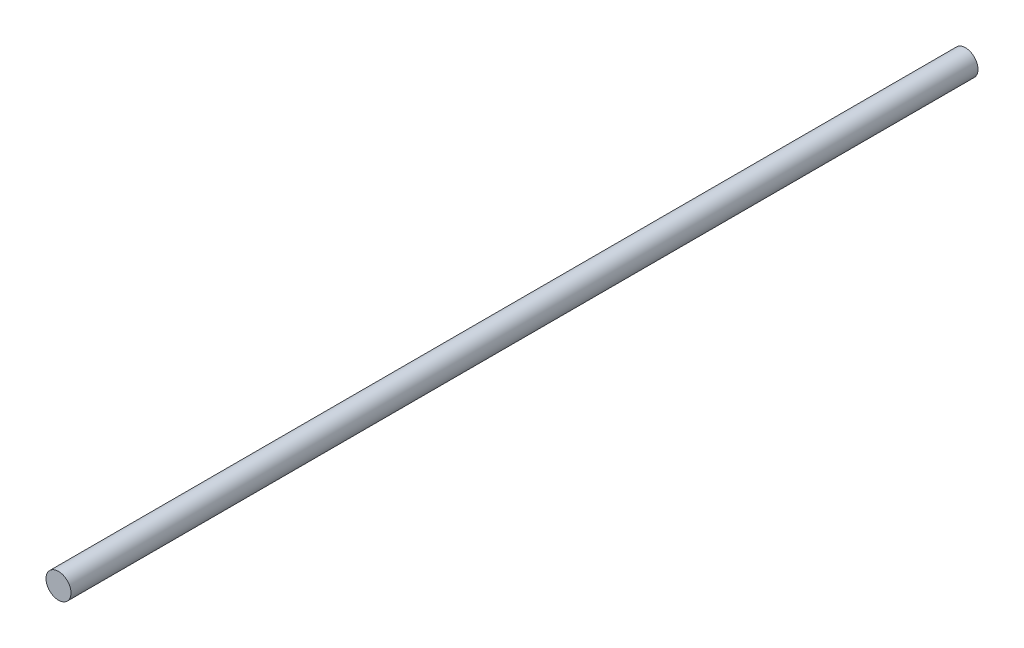
from build123d import *

# Parameters (mm, degrees)
SKETCH2_W = 290
SKETCH2_H = 4


with BuildPart() as part:
    # Sketch2 → Revolve1 (revolve)
    with BuildSketch(Plane(origin=(0, 0, 0), x_dir=(0, 0, -1), z_dir=(1, 0, 0))):
        with Locations((145, 2)):
            Rectangle(SKETCH2_W, SKETCH2_H)
    revolve(axis=Axis((0, 0, 0), (0, 0, -1)))


solid = part.part
